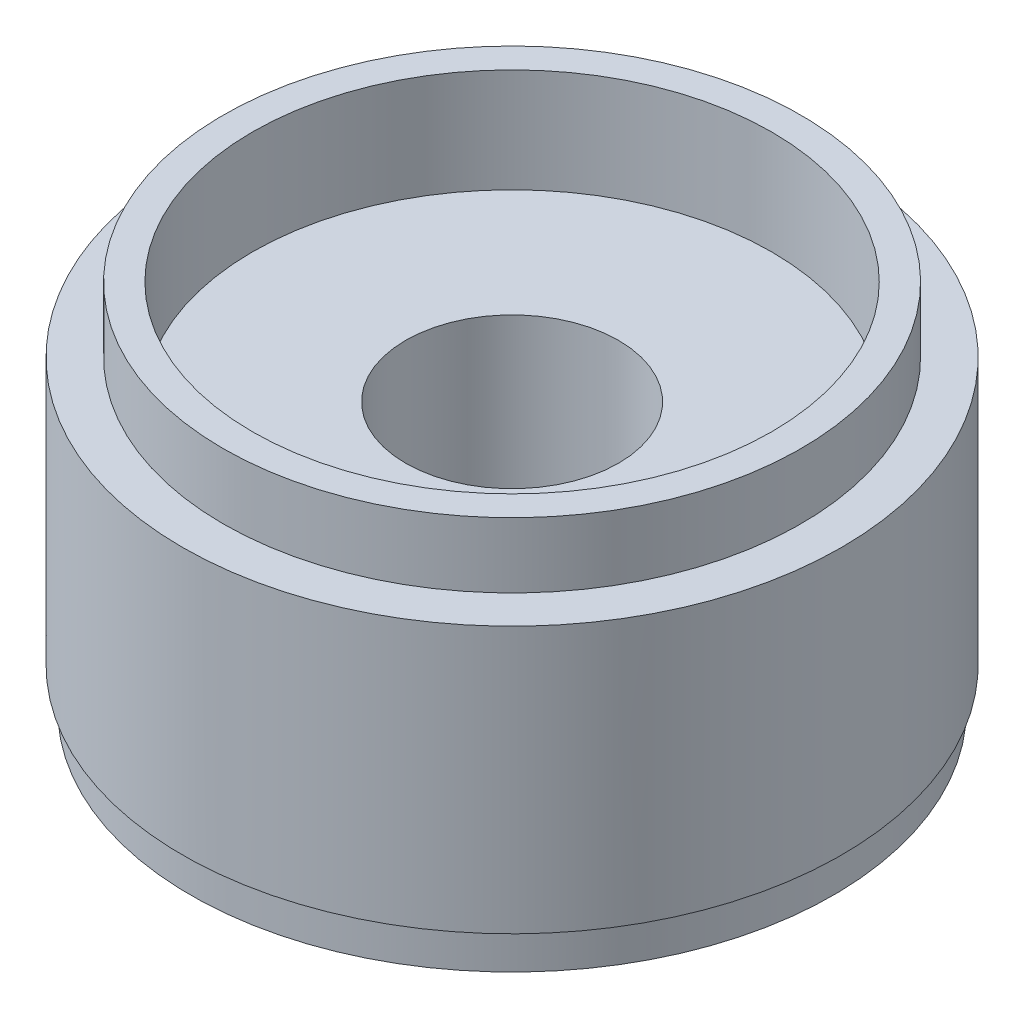
from build123d import *

# Parameters (mm, degrees)
SKETCH1_R           = 25.385
BOSS_EXTRUDE1_DEPTH = 28.54
SKETCH2_OUTSIDE_W   = 68.222
SKETCH2_OUTSIDE_H   = 68.222
SKETCH2_OUTSIDE_R   = 24.75
CUT_EXTRUDE1_DEPTH  = 3
SKETCH3_OUTSIDE_W   = 68.222
SKETCH3_OUTSIDE_H   = 68.222
SKETCH3_OUTSIDE_R   = 22.25
CUT_EXTRUDE2_DEPTH  = 5.02
SKETCH4_R           = 20
CUT_EXTRUDE3_DEPTH  = 8
SKETCH5_R           = 8.2
CUT_EXTRUDE4_DEPTH  = 46.862054577
SKETCH6_R           = 13.5
CUT_EXTRUDE5_DEPTH  = 5


with BuildPart() as part:
    # Sketch1 → Boss-Extrude1 (new body)
    with BuildSketch(Plane(origin=(0, 0, 0), x_dir=(1, 0, 0), z_dir=(0, 1, 0))):
        Circle(SKETCH1_R)
    extrude(amount=BOSS_EXTRUDE1_DEPTH)

    # Sketch2 outside → Cut-Extrude1 (cut)
    with BuildSketch(Plane.XZ):
        Rectangle(SKETCH2_OUTSIDE_W, SKETCH2_OUTSIDE_H)
        Circle(SKETCH2_OUTSIDE_R, mode=Mode.SUBTRACT)
    extrude(amount=-CUT_EXTRUDE1_DEPTH, mode=Mode.SUBTRACT)

    # Sketch3 outside → Cut-Extrude2 (cut)
    with BuildSketch(Plane(origin=(0, 28.54, 0), x_dir=(1, 0, 0), z_dir=(0, 1, 0))):
        Rectangle(SKETCH3_OUTSIDE_W, SKETCH3_OUTSIDE_H)
        Circle(SKETCH3_OUTSIDE_R, mode=Mode.SUBTRACT)
    extrude(amount=-CUT_EXTRUDE2_DEPTH, mode=Mode.SUBTRACT)

    # Sketch4 → Cut-Extrude3 (cut)
    with BuildSketch(Plane(origin=(0, 28.54, 0), x_dir=(1, 0, 0), z_dir=(0, 1, 0))):
        Circle(SKETCH4_R)
    extrude(amount=-CUT_EXTRUDE3_DEPTH, mode=Mode.SUBTRACT)

    # Sketch5 → Cut-Extrude4 (cut, through all)
    with BuildSketch(Plane.XZ):
        Circle(SKETCH5_R)
    extrude(amount=-CUT_EXTRUDE4_DEPTH, mode=Mode.SUBTRACT)

    # Sketch6 → Cut-Extrude5 (cut)
    with BuildSketch(Plane.XZ):
        Circle(SKETCH6_R)
    extrude(amount=-CUT_EXTRUDE5_DEPTH, mode=Mode.SUBTRACT)


solid = part.part
